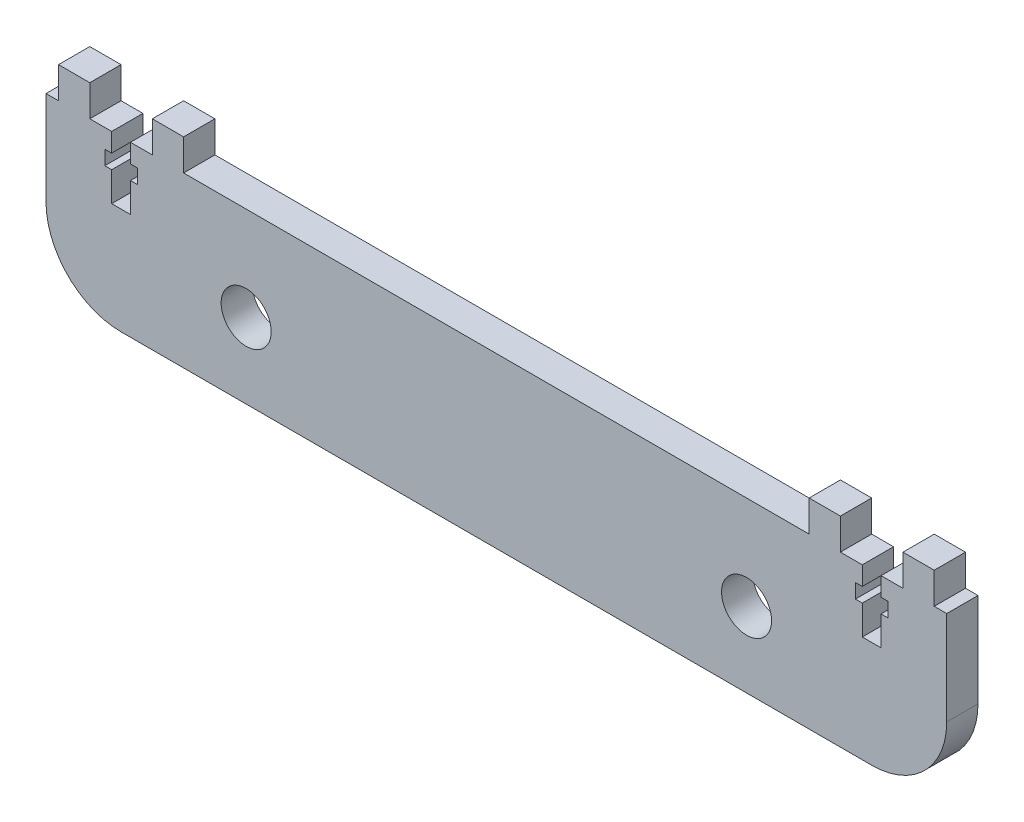
from build123d import *

# Parameters (mm, degrees)
SKETCH1_R           = 4
BOSS_EXTRUDE2_DEPTH = 5


with BuildPart() as part:
    # Sketch1 → Boss-Extrude2 (new body)
    with BuildSketch(Plane.XY):
        with BuildLine():
            Line((-72, 15), (-72, 0))
            ThreePointArc((-72, 0), (-68.485281374, -8.485281374), (-60, -12))
            Line((-60, -12), (60, -12))
            ThreePointArc((60, -12), (68.485281374, -8.485281374), (72, 0))
            Line((72, 0), (72, 15))
            Line((72, 15), (70, 15))
            Line((70, 15), (70, 20))
            Line((70, 20), (65, 20))
            Line((65, 20), (65, 15))
            Line((65, 15), (61.5, 15))
            Line((61.5, 15), (61.5, 12))
            Line((61.5, 12), (62.6, 12))
            Line((62.6, 12), (62.6, 9.7))
            Line((62.6, 9.7), (61.5, 9.7))
            Line((61.5, 9.7), (61.5, 5))
            Line((61.5, 5), (58.5, 5))
            Line((58.5, 5), (58.5, 9.7))
            Line((58.5, 9.7), (57.4, 9.7))
            Line((57.4, 9.7), (57.4, 12))
            Line((57.4, 12), (58.5, 12))
            Line((58.5, 12), (58.5, 15))
            Line((58.5, 15), (55, 15))
            Line((55, 15), (55, 20))
            Line((55, 20), (50, 20))
            Line((50, 20), (50, 15))
            Line((50, 15), (-50, 15))
            Line((-50, 15), (-50, 20))
            Line((-50, 20), (-55, 20))
            Line((-55, 20), (-55, 15))
            Line((-55, 15), (-58.5, 15))
            Line((-58.5, 15), (-58.5, 12))
            Line((-58.5, 12), (-57.4, 12))
            Line((-57.4, 12), (-57.4, 9.7))
            Line((-57.4, 9.7), (-58.5, 9.7))
            Line((-58.5, 9.7), (-58.5, 5))
            Line((-58.5, 5), (-61.5, 5))
            Line((-61.5, 5), (-61.5, 9.7))
            Line((-61.5, 9.7), (-62.6, 9.7))
            Line((-62.6, 9.7), (-62.6, 12))
            Line((-62.6, 12), (-61.5, 12))
            Line((-61.5, 12), (-61.5, 15))
            Line((-61.5, 15), (-65, 15))
            Line((-65, 15), (-65, 20))
            Line((-65, 20), (-70, 20))
            Line((-70, 20), (-70, 15))
            Line((-70, 15), (-72, 15))
        make_face()
        with Locations((-40, 0)):
            Circle(SKETCH1_R, mode=Mode.SUBTRACT)
        with Locations((40, 0)):
            Circle(SKETCH1_R, mode=Mode.SUBTRACT)
    extrude(amount=BOSS_EXTRUDE2_DEPTH)


solid = part.part
